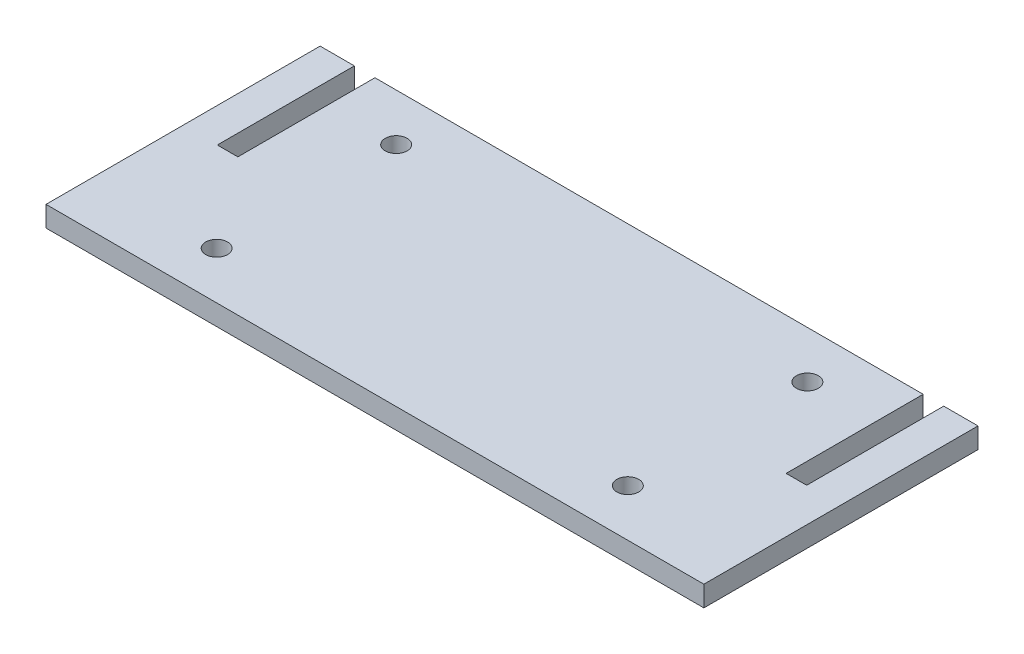
from build123d import *

# Parameters (mm, degrees)
SKETCH1_R           = 1.6
BOSS_EXTRUDE1_DEPTH = 3


with BuildPart() as part:
    # Sketch1 → Boss-Extrude1 (new body)
    with BuildSketch(Plane(origin=(0, 0, 0), x_dir=(1, 0, 0), z_dir=(0, 1, 0))):
        Polygon((-48, -20), (48, -20), (48, 20), (43, 20), (43, 0), (40, 0), (40, 20), (-40, 20), (-40, 0), (-43, 0), (-43, 20), (-48, 20), align=None)
        with Locations((-30, 13.1)):
            Circle(SKETCH1_R, mode=Mode.SUBTRACT)
        with Locations((30, 13.1)):
            Circle(SKETCH1_R, mode=Mode.SUBTRACT)
        with Locations((30, -13.1)):
            Circle(SKETCH1_R, mode=Mode.SUBTRACT)
        with Locations((-30, -13.1)):
            Circle(SKETCH1_R, mode=Mode.SUBTRACT)
    extrude(amount=BOSS_EXTRUDE1_DEPTH)


solid = part.part
